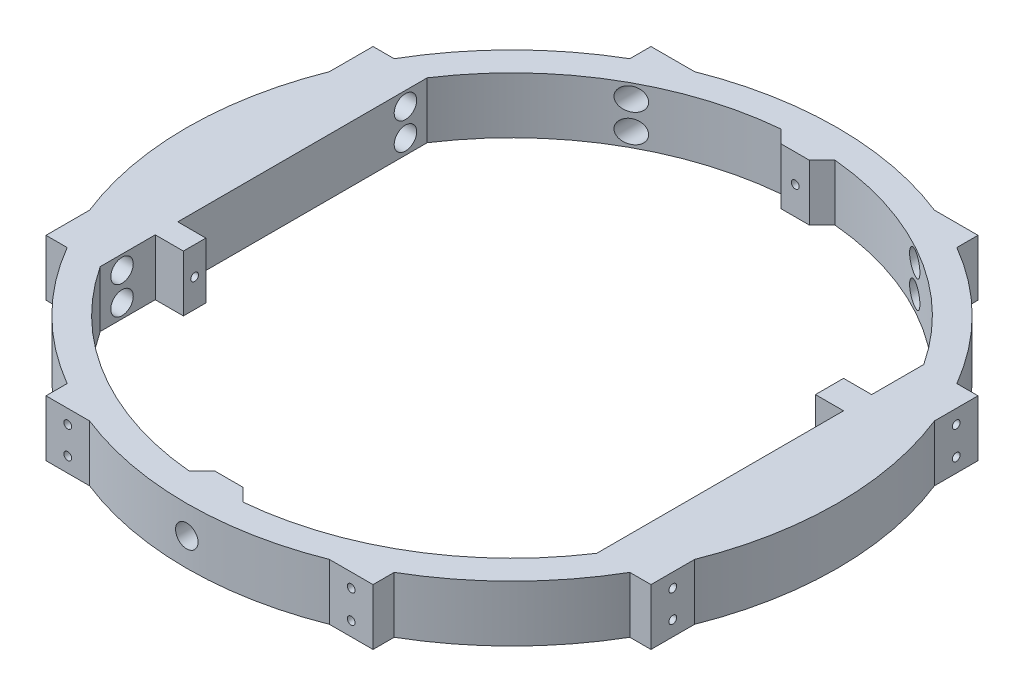
from build123d import *

# Parameters (mm, degrees)
SKETCH2_R             = 147.000716967
BOSS_EXTRUDE1_DEPTH   = 25.4
SKETCH3_R             = 1.7526
CUT_EXTRUDE1_DEPTH    = 25.4
CUT_EXTRUDE2_START    = -10.16
SKETCH4_R             = 5.08
CUT_EXTRUDE2_DEPTH    = 25.4
CIRPATTERN1_START     = -10.16
CIRPATTERN1_OUTLINE_R = 1.7526
CIRPATTERN1_DEPTH     = 10.814416157
CIRPATTERN2_COUNT     = 2
BOSS_EXTRUDE3_START   = -25.4
BOSS_EXTRUDE3_DEPTH   = 25.4
SKETCH12_R            = 1.7526
CUT_EXTRUDE5_DEPTH    = 29.718
CIRPATTERN3_COUNT     = 4
SKETCH13_W            = 10.16
SKETCH13_H            = 25.4
SKETCH13_R            = 1.7526
BOSS_EXTRUDE4_DEPTH   = 12.7
SKETCH18_W            = 12.7
SKETCH18_H            = 25.4
SKETCH18_R            = 1.7526
BOSS_EXTRUDE5_DEPTH   = 12.7
CUT_EXTRUDE6_START    = -24.493451
SKETCH16_R            = 5.08
CUT_EXTRUDE6_DEPTH    = 12.7
CUT_EXTRUDE7_START    = -25.4
SKETCH19_R            = 5.08
CUT_EXTRUDE7_DEPTH    = 19.05
CUT_EXTRUDE8_START    = -12.7
SKETCH20_R            = 5.08
CUT_EXTRUDE8_DEPTH    = 12.7
CUT_EXTRUDE9_START    = -6.35
SKETCH21_R            = 5.08
CUT_EXTRUDE9_DEPTH    = 19.05


# Read off the part's stored shape, not the designer's step: CirPattern1
with BuildPart() as part:
    # Sketch2 → Boss-Extrude1 (new body)
    with BuildSketch(Plane(origin=(0, 0, 0), x_dir=(1, 0, 0), z_dir=(0, 1, 0))):
        with Locations(Location((-232.087586101, -128.605133124, 0), (0, 0, 270))):
            Circle(SKETCH2_R)
        with BuildLine():
            Line((-119.925646441, -54.737806994), (-119.925646441, -202.472459254))
            ThreePointArc((-119.925646441, -202.472459254), (-163.096221326, -243.830452235), (-219.938251664, -262.355184528))
            Line((-219.938251664, -262.355184528), (-225.737586101, -256.555850091))
            Line((-225.737586101, -256.555850091), (-238.437586101, -256.555850091))
            Line((-238.437586101, -256.555850091), (-244.236920538, -262.355184528))
            ThreePointArc((-244.236920538, -262.355184528), (-301.077980758, -243.831033089), (-344.248281925, -202.47434789))
            Line((-344.248281925, -202.47434789), (-344.248281925, -54.735918358))
            ThreePointArc((-344.248281925, -54.735918358), (-301.077980758, -13.379233159), (-244.236920538, 5.14491828))
            Line((-244.236920538, 5.14491828), (-238.437586101, -0.654416157))
            Line((-238.437586101, -0.654416157), (-225.737586101, -0.654416157))
            Line((-225.737586101, -0.654416157), (-219.938251664, 5.14491828))
            ThreePointArc((-219.938251664, 5.14491828), (-163.096221326, -13.379814013), (-119.925646441, -54.737806994))
        make_face(mode=Mode.SUBTRACT)
    extrude(amount=BOSS_EXTRUDE1_DEPTH)

    # Sketch3 → Cut-Extrude1 (cut)
    with BuildSketch(Plane(origin=(0, 0, 256.555850091), x_dir=(-1, 0, 0), z_dir=(0, 0, -1))):
        with Locations((232.087586101, 12.7)):
            Circle(SKETCH3_R)
    extrude(amount=-CUT_EXTRUDE1_DEPTH, mode=Mode.SUBTRACT)

    # Sketch4 → Cut-Extrude2 (cut)
    with BuildSketch(Plane.XY.offset(CUT_EXTRUDE2_START)):
        with Locations((-232.087586101, 12.7)):
            Circle(SKETCH4_R)
    cut_extrude2 = extrude(amount=-CUT_EXTRUDE2_DEPTH, mode=Mode.SUBTRACT)

    # CirPattern1 outline → CirPattern1 (cut)
    with BuildSketch(Plane.XY.offset(CIRPATTERN1_START)):
        with Locations((-232.087586101, 12.7)):
            Circle(CIRPATTERN1_OUTLINE_R)
    extrude(amount=CIRPATTERN1_DEPTH, mode=Mode.SUBTRACT)

    # CirPattern2: Cut-Extrude2 ×2 about axis
    cirpattern2_axis = Axis((-232.087586101, 0, 128.605133124), (0, -1, 0))
    for i in range(1, CIRPATTERN2_COUNT):
        add(cut_extrude2.rotate(cirpattern2_axis, i * 360 / CIRPATTERN2_COUNT), mode=Mode.SUBTRACT)

    # Sketch11 → Boss-Extrude3 (add)
    with BuildSketch(Plane(origin=(0, 25.4, 0), x_dir=(1, 0, 0), z_dir=(0, 1, 0)).offset(BOSS_EXTRUDE3_START)):
        with BuildLine():
            Line((-368.741732918, -54.735918358), (-368.741732918, -74.430831593))
            ThreePointArc((-368.741732918, -74.430831593), (-364.328161839, -64.40512598), (-359.180268418, -54.735918358))
            Line((-359.180268418, -54.735918358), (-368.741732918, -54.735918358))
        make_face()
        with BuildLine():
            ThreePointArc((-359.180268418, -202.47434789), (-364.328161839, -192.805140268), (-368.741732918, -182.779434655))
            Line((-368.741732918, -182.779434655), (-368.741732918, -202.47434789))
            Line((-368.741732918, -202.47434789), (-359.180268418, -202.47434789))
        make_face()
    boss_extrude3 = extrude(amount=BOSS_EXTRUDE3_DEPTH)

    # Sketch12 → Cut-Extrude5 (cut)
    with BuildSketch(Plane.ZY.offset(368.741732918)):
        with Locations((192.626891272, 19.05)):
            Circle(SKETCH12_R)
        with Locations((192.626891272, 6.35)):
            Circle(SKETCH12_R)
        with Locations((64.583374976, 6.73055807)):
            Circle(SKETCH12_R)
        with Locations((64.583374976, 19.05)):
            Circle(SKETCH12_R)
    cut_extrude5 = extrude(amount=-CUT_EXTRUDE5_DEPTH, mode=Mode.SUBTRACT)

    # CirPattern3: Boss-Extrude3, Cut-Extrude5 ×4 about axis
    cirpattern3_axis = Axis((-232.087586101, 0, 128.605133124), (0, 1, 0))
    add([boss_extrude3.rotate(cirpattern3_axis, i * 360 / CIRPATTERN3_COUNT) for i in range(1, CIRPATTERN3_COUNT)])
    add([cut_extrude5.rotate(cirpattern3_axis, i * 360 / CIRPATTERN3_COUNT) for i in range(1, CIRPATTERN3_COUNT)], mode=Mode.SUBTRACT)

    # Sketch13 → Boss-Extrude4 (add)
    with BuildSketch(Plane(origin=(-344.248281925, 0, 0), x_dir=(0, 0, -1), z_dir=(1, 0, 0))):
        with Locations((-172.527111721, 12.7)):
            Rectangle(SKETCH13_W, SKETCH13_H)
        with Locations((-172.527111721, 12.7)):
            Circle(SKETCH13_R, mode=Mode.SUBTRACT)
    extrude(amount=BOSS_EXTRUDE4_DEPTH)

    # Sketch18 → Boss-Extrude5 (add)
    with BuildSketch(Plane.ZY.offset(119.925646441)):
        with Locations((84.634439784, 12.7)):
            Rectangle(SKETCH18_W, SKETCH18_H)
        with Locations((84.634439784, 12.7)):
            Circle(SKETCH18_R, mode=Mode.SUBTRACT)
    extrude(amount=BOSS_EXTRUDE5_DEPTH)

    # Sketch16 → Cut-Extrude6 (cut)
    with BuildSketch(Plane.ZY.offset(368.741732918).offset(CUT_EXTRUDE6_START)):
        with Locations(Location((192.626891272, 19.05, 0), (0, 0, 180))):
            Circle(SKETCH16_R)
        with Locations(Location((192.626891272, 6.35, 0), (0, 0, 180))):
            Circle(SKETCH16_R)
        with Locations(Location((64.583374976, 6.73055807, 0), (0, 0, 180))):
            Circle(SKETCH16_R)
        with Locations(Location((64.583374976, 19.05, 0), (0, 0, 180))):
            Circle(SKETCH16_R)
    extrude(amount=CUT_EXTRUDE6_DEPTH, mode=Mode.SUBTRACT)

    # Sketch19 → Cut-Extrude7 (cut)
    with BuildSketch(Plane.XY.offset(265.259279942).offset(CUT_EXTRUDE7_START)):
        with Locations(Location((-168.065827953, 19.05, 0), (0, 0, 180))):
            Circle(SKETCH19_R)
        with Locations(Location((-168.065827953, 6.35, 0), (0, 0, 180))):
            Circle(SKETCH19_R)
        with Locations(Location((-296.109344249, 19.05, 0), (0, 0, 180))):
            Circle(SKETCH19_R)
        with Locations(Location((-296.109344249, 6.73055807, 0), (0, 0, 180))):
            Circle(SKETCH19_R)
    extrude(amount=CUT_EXTRUDE7_DEPTH, mode=Mode.SUBTRACT)

    # Sketch20 → Cut-Extrude8 (cut)
    with BuildSketch(Plane.ZY.offset(119.925646441).offset(CUT_EXTRUDE8_START)):
        with Locations(Location((192.626891272, 19.05, 0), (0, 0, 180))):
            Circle(SKETCH20_R)
        with Locations((192.626891272, 6.73055807)):
            Circle(SKETCH20_R)
        with Locations(Location((64.583374976, 19.05, 0), (0, 0, 180))):
            Circle(SKETCH20_R)
        with Locations(Location((64.583374976, 6.73055807, 0), (0, 0, 180))):
            Circle(SKETCH20_R)
    extrude(amount=CUT_EXTRUDE8_DEPTH, mode=Mode.SUBTRACT)

    # Sketch21 → Cut-Extrude9 (cut)
    with BuildSketch(Plane(origin=(0, 0, -8.049013693), x_dir=(-1, 0, 0), z_dir=(0, 0, -1)).offset(CUT_EXTRUDE9_START)):
        with Locations((296.109344249, 19.05)):
            Circle(SKETCH21_R)
        with Locations(Location((296.109344249, 6.35, 0), (0, 0, 180))):
            Circle(SKETCH21_R)
        with Locations((168.065827953, 19.05)):
            Circle(SKETCH21_R)
        with Locations(Location((168.065827953, 6.73055807, 0), (0, 0, 180))):
            Circle(SKETCH21_R)
    extrude(amount=-CUT_EXTRUDE9_DEPTH, mode=Mode.SUBTRACT)


solid = part.part
